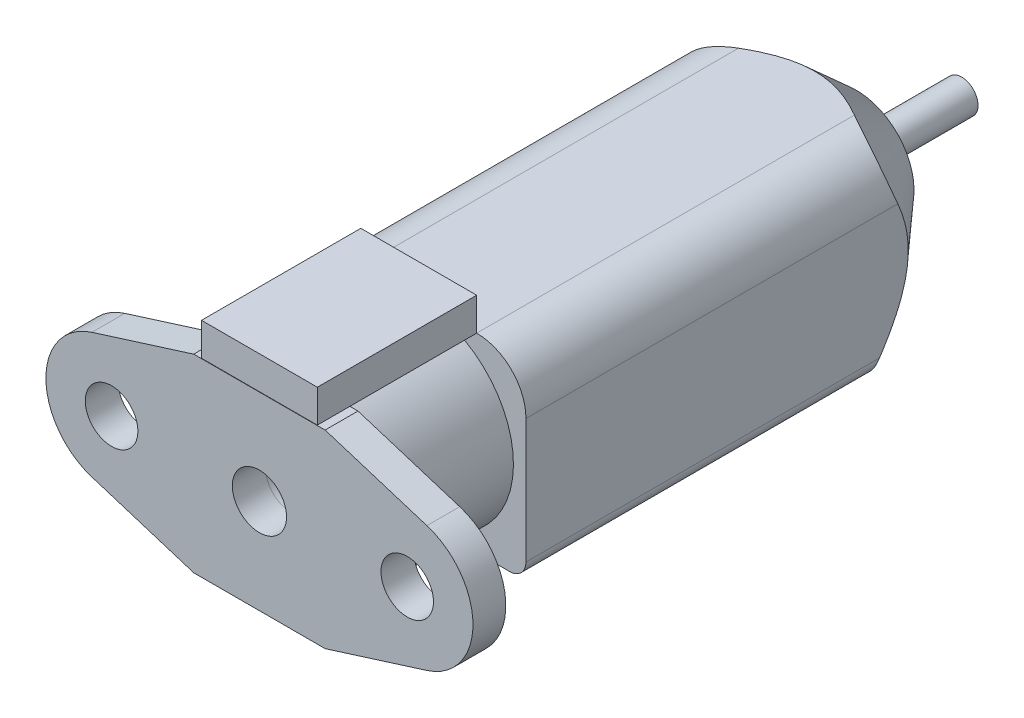
from build123d import *

# Parameters (mm, degrees)
CROQUIS1_R               = 1.598160281
CROQUIS1_R_2             = 1.600993429
CROQUIS1_R_3             = 1.650918845
SALIENTE_EXTRUIR7_DEPTH  = 2
CROQUIS2_R               = 5.764999893
CROQUIS2_R_2             = 1.651186543
SALIENTE_EXTRUIR8_DEPTH  = 7.7
SALIENTE_EXTRUIR9_DEPTH  = 26.65
CROQUIS6_R               = 0.999415005
SALIENTE_EXTRUIR10_DEPTH = 6.4
CROQUIS7_W               = 7.053736916
CROQUIS7_H               = 9.7
SALIENTE_EXTRUIR11_DEPTH = 2


with BuildPart() as part:
    # Croquis1 → Saliente-Extruir7 (new body)
    with BuildSketch(Plane.XY):
        with BuildLine():
            Line((4.00000019, 5.763000809), (10.195969576, 3.8191034))
            ThreePointArc((10.195969576, 3.8191034), (12.999977706, 0.001566069), (10.197782, -3.817301838))
            Line((10.197782, -3.817301838), (4.00000019, -5.764999893))
            Line((4.00000019, -5.764999893), (-4.00000019, -5.764999893))
            Line((-4.00000019, -5.764999893), (-10.199065979, -3.817665654))
            ThreePointArc((-10.199065979, -3.817665654), (-13.000622723, -0.001109837), (-10.199143851, 3.815503142))
            Line((-10.199143851, 3.815503142), (-4.00000019, 5.763000809))
            Line((-4.00000019, 5.763000809), (4.00000019, 5.763000809))
        make_face()
        with Locations((8.997973452, 0.000616233)):
            Circle(CROQUIS1_R, mode=Mode.SUBTRACT)
        with Locations((-9.000145119, -0.001069025)):
            Circle(CROQUIS1_R_2, mode=Mode.SUBTRACT)
        Circle(CROQUIS1_R_3, mode=Mode.SUBTRACT)
    extrude(amount=-SALIENTE_EXTRUIR7_DEPTH)

    # Croquis2 → Saliente-Extruir8 (add)
    with BuildSketch(Plane(origin=(0, 0, -2), x_dir=(-1, 0, 0), z_dir=(0, 0, -1))):
        Circle(CROQUIS2_R)
        Circle(CROQUIS2_R_2, mode=Mode.SUBTRACT)
    extrude(amount=SALIENTE_EXTRUIR8_DEPTH)

    # Croquis3 → Saliente-Extruir9 (add)
    with BuildSketch(Plane(origin=(0, 0, -9.7), x_dir=(-1, 0, 0), z_dir=(0, 0, -1))):
        with BuildLine():
            Line((3.526868458, 5.783774708), (-3.526868458, 5.783774708))
            ThreePointArc((-3.526868458, 5.783774708), (-5.648188802, 4.905095052), (-6.526868458, 2.783774708))
            Line((-6.526868458, 2.783774708), (-6.526868458, -4.783774708))
            ThreePointArc((-6.526868458, -4.783774708), (-6.233975239, -5.490881489), (-5.526868458, -5.783774708))
            Line((-5.526868458, -5.783774708), (5.526868458, -5.783774708))
            ThreePointArc((5.526868458, -5.783774708), (6.233975239, -5.490881489), (6.526868458, -4.783774708))
            Line((6.526868458, -4.783774708), (6.526868458, 2.783774708))
            ThreePointArc((6.526868458, 2.783774708), (5.648188802, 4.905095052), (3.526868458, 5.783774708))
        make_face()
    extrude(amount=SALIENTE_EXTRUIR9_DEPTH)

    # Croquis5 → Cortar-Revolución1 (revolve, cut)
    with BuildSketch(Plane(origin=(0, 0, 0), x_dir=(1, 0, 0), z_dir=(0, 1, 0))):
        Polygon((-3.5, 36.35), (-8.472559386, 30.803521887), (-8.472559386, 36.35), align=None)
    revolve(axis=Axis((0, 0, -39.9199001), (0, 0, 1)), mode=Mode.SUBTRACT)

    # Croquis6 → Saliente-Extruir10 (add)
    with BuildSketch(Plane(origin=(0, 0, -36.35), x_dir=(-1, 0, 0), z_dir=(0, 0, -1))):
        Circle(CROQUIS6_R)
    extrude(amount=SALIENTE_EXTRUIR10_DEPTH)


with BuildPart() as body_2:
    # Croquis7 → Saliente-Extruir11 (new body)
    with BuildSketch(Plane(origin=(0, 5.783774708, 0), x_dir=(1, 0, 0), z_dir=(0, 1, 0))):
        with Locations((0, 4.85)):
            Rectangle(CROQUIS7_W, CROQUIS7_H)
    extrude(amount=SALIENTE_EXTRUIR11_DEPTH)


solid = Compound([part.part, body_2.part])
